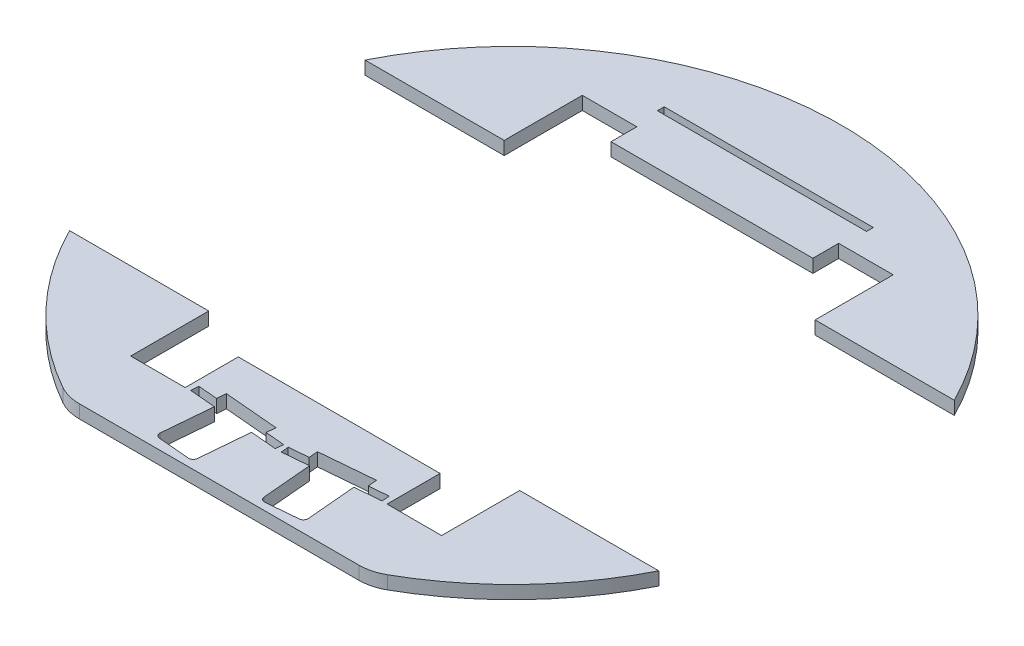
from build123d import *

# Parameters (mm, degrees)
BOSS_EXTRUDE1_DEPTH = 2.9
CUT_EXTRUDE1_DEPTH  = 103.571487266
SKETCH3_W           = 38.3
SKETCH3_H           = 65
CUT_EXTRUDE2_DEPTH  = 103.571487266
CUT_EXTRUDE3_DEPTH  = 98.286484159
CUT_EXTRUDE4_DEPTH  = 98.286484159
SKETCH6_W           = 46
SKETCH6_H           = 1.5
CUT_EXTRUDE5_DEPTH  = 98.286484159


with BuildPart() as part:
    # Sketch1 → Boss-Extrude1 (new body)
    with BuildSketch(Plane(origin=(0, 0, 0), x_dir=(1, 0, 0), z_dir=(0, 1, 0))):
        with BuildLine():
            Line((-30.763446914, -64.404598464), (30.763446914, -64.404598464))
            ThreePointArc((30.763446914, -64.404598464), (33.308308644, -64.075362589), (35.68559842, -63.109334218))
            ThreePointArc((35.68559842, -63.109334218), (0, 72.5), (-35.68559842, -63.109334218))
            ThreePointArc((-35.68559842, -63.109334218), (-33.308308644, -64.075362589), (-30.763446914, -64.404598464))
        make_face()
    extrude(amount=BOSS_EXTRUDE1_DEPTH)

    # Sketch2 → Cut-Extrude1 (cut, through all)
    with BuildSketch(Plane(origin=(0, 2.9, 0), x_dir=(1, 0, 0), z_dir=(0, 1, 0))):
        Polygon((-34.2, -49.675685802), (-22.2, -49.675685802), (-22.2, -38), (22.2, -38), (22.2, -49.675685802), (34.2, -49.675685802), (34.2, 49.675685802), (22.2, 49.675685802), (22.2, 44), (-22.2, 44), (-22.2, 49.675685802), (-34.2, 49.675685802), align=None)
    extrude(amount=-CUT_EXTRUDE1_DEPTH, mode=Mode.SUBTRACT)

    # Sketch3 → Cut-Extrude2 (cut, through all)
    with BuildSketch(Plane(origin=(0, 2.9, 0), x_dir=(1, 0, 0), z_dir=(0, 1, 0))):
        with Locations((-53.35, 0)):
            Rectangle(SKETCH3_W, SKETCH3_H)
        with Locations((53.35, 0)):
            Rectangle(SKETCH3_W, SKETCH3_H)
    extrude(amount=-CUT_EXTRUDE2_DEPTH, mode=Mode.SUBTRACT)


with BuildPart() as cut_extrude2_piece_1:
    # of the separate pieces the step leaves, piece 1, a body of its own (cut_extrude2_pieces)
    add(part.part.solids().sort_by_distance((64.807406984, 0, -32.5))[0])

    # Sketch6 → Cut-Extrude5 (cut, through all)
    with BuildSketch(Plane(origin=(0, 2.9, 0), x_dir=(1, 0, 0), z_dir=(0, 1, 0))):
        with Locations((0, 55.75)):
            Rectangle(SKETCH6_W, SKETCH6_H)
    extrude(amount=-CUT_EXTRUDE5_DEPTH, mode=Mode.SUBTRACT)


with BuildPart() as cut_extrude2_piece_2:
    # of the separate pieces the step leaves, piece 2, a body of its own (cut_extrude2_pieces)
    add(part.part.solids().sort_by_distance((-35.68559842, 0, 63.109334218))[0])

    # Sketch4 → Cut-Extrude3 (cut, through all)
    with BuildSketch(Plane(origin=(0, 2.9, 0), x_dir=(1, 0, 0), z_dir=(0, 1, 0))):
        Polygon((-21.070156074, -49.617905737), (-0.648164763, -51.404598464), (-0.5, -49.711067477), (-20.921991311, -47.924374751), align=None)
        Polygon((21.070156074, -49.617905737), (20.921991311, -47.924374751), (0.5, -49.711067477), (0.648164763, -51.404598464), align=None)
    extrude(amount=-CUT_EXTRUDE3_DEPTH, mode=Mode.SUBTRACT)

    # Sketch5 → Cut-Extrude4 (cut, through all)
    with BuildSketch(Plane(origin=(0, 2.9, 0), x_dir=(1, 0, 0), z_dir=(0, 1, 0))):
        with BuildLine():
            Line((6.376284277, -50.903452943), (15.34203656, -50.119051258))
            Line((15.34203656, -50.119051258), (16.30074973, -61.077192937))
            ThreePointArc((16.30074973, -61.077192937), (16.070599475, -61.80713629), (15.391710774, -62.160543378))
            Line((15.391710774, -62.160543378), (8.418347888, -62.770633577))
            ThreePointArc((8.418347888, -62.770633577), (7.688404535, -62.540483322), (7.334997447, -61.861594622))
            Line((7.334997447, -61.861594622), (6.376284277, -50.903452943))
        make_face()
        Polygon((16.688163844, -48.294786657), (4.733827467, -49.34065557), (4.559515981, -47.348266174), (16.513852358, -46.302397261), align=None)
        Polygon((-16.513852358, -46.302397261), (-4.559515981, -47.348266174), (-4.733827467, -49.34065557), (-16.688163844, -48.294786657), align=None)
        with BuildLine():
            Line((-8.418347888, -62.770633577), (-15.391710774, -62.160543378))
            ThreePointArc((-15.391710774, -62.160543378), (-16.070599475, -61.80713629), (-16.30074973, -61.077192937))
            Line((-16.30074973, -61.077192937), (-15.34203656, -50.119051258))
            Line((-15.34203656, -50.119051258), (-6.376284277, -50.903452943))
            Line((-6.376284277, -50.903452943), (-7.334997447, -61.861594622))
            ThreePointArc((-7.334997447, -61.861594622), (-7.688404535, -62.540483322), (-8.418347888, -62.770633577))
        make_face()
    extrude(amount=-CUT_EXTRUDE4_DEPTH, mode=Mode.SUBTRACT)


solid = Compound([cut_extrude2_piece_1.part, cut_extrude2_piece_2.part])
